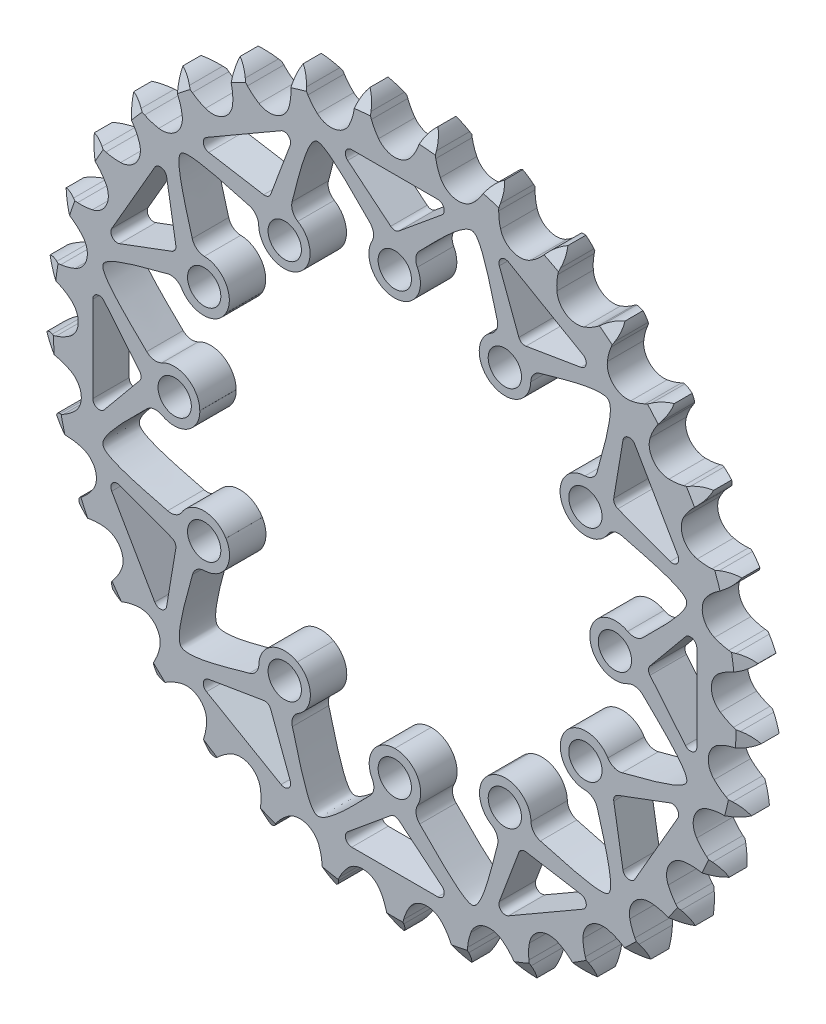
from build123d import *

# Parameters (mm, degrees)
EXTRUSION_DEPTH          = 7.2136
CIRPATTERN1_COUNT        = 12
CUT_EXTRUDE1_DEPTH       = 101.397293257
CUT_EXTRUDE1_DEPTH_BACK  = 101.397293257
SKETCH8_R                = 37
CUT_EXTRUDE4_DEPTH       = 101.397293405
FILLET3_R                = 2.54
CIRPATTERN5_COUNT        = 12
FILLET3_OF_CIRPATTERN5_R = 2.54


with BuildPart() as part:
    # Teeth Sketch → Extrusion (new body)
    with BuildSketch(Plane.XY):
        with BuildLine():
            ThreePointArc((6.734552875, 70.527428506), (5.727412099, 69.369502295), (5.022388138, 68.006393031))
            Line((5.022388138, 68.006393031), (4.635162245, 66.971544668))
            ThreePointArc((4.635162245, 66.971544668), (4.0137299, 65.635158722), (3.209237245, 64.400291471))
            ThreePointArc((3.209237245, 64.400291471), (0, 62.793862006), (-3.209237245, 64.400291471))
            ThreePointArc((-3.209237245, 64.400291471), (-4.0137299, 65.635158722), (-4.635162245, 66.971544668))
            Line((-4.635162245, 66.971544668), (-5.022388138, 68.006393031))
            ThreePointArc((-5.022388138, 68.006393031), (-5.727412099, 69.369502295), (-6.734552875, 70.527428506))
            ThreePointArc((-6.734552875, 70.527428506), (-7.504354329, 69.199824885), (-7.938667464, 67.727922119))
            Line((-7.938667464, 67.727922119), (-8.123049341, 66.638491832))
            ThreePointArc((-8.123049341, 66.638491832), (-8.48033889, 65.208649276), (-9.036593151, 63.84384645))
            ThreePointArc((-9.036593151, 63.84384645), (-11.883816523, 61.659095115), (-15.339077445, 62.629142165))
            ThreePointArc((-15.339077445, 62.629142165), (-16.362732034, 63.68944252), (-17.22584699, 64.884071387))
            Line((-17.22584699, 64.884071387), (-17.801921547, 65.826935709))
            ThreePointArc((-17.801921547, 65.826935709), (-18.752174931, 67.031985151), (-19.960254337, 67.978383482))
            ThreePointArc((-19.960254337, 67.978383482), (-20.464893839, 66.529085505), (-20.61279894, 65.001587639))
            Line((-20.61279894, 65.001587639), (-20.587672758, 63.896950277))
            ThreePointArc((-20.587672758, 63.896950277), (-20.667906137, 62.425329346), (-20.955817525, 60.979918474))
            ThreePointArc((-20.955817525, 60.979918474), (-23.338120953, 58.295807876), (-26.914523421, 58.594412483))
            ThreePointArc((-26.914523421, 58.594412483), (-28.120342399, 59.441823925), (-29.193944743, 60.451518712))
            Line((-29.193944743, 60.451518712), (-29.938047129, 61.268321421))
            ThreePointArc((-29.938047129, 61.268321421), (-31.099185303, 62.271757414), (-32.464540202, 62.972422563))
            ThreePointArc((-32.464540202, 62.972422563), (-32.685778765, 61.453811636), (-32.541930156, 59.925926421))
            Line((-32.541930156, 59.925926421), (-32.308204042, 58.846006456))
            ThreePointArc((-32.308204042, 58.846006456), (-32.108481407, 57.385795366), (-32.117644055, 55.912017363))
            ThreePointArc((-32.117644055, 55.912017363), (-33.948924886, 52.825558252), (-37.517208396, 52.441928068))
            ThreePointArc((-37.517208396, 52.441928068), (-38.861610323, 53.045822938), (-40.106897269, 53.834090646))
            Line((-40.106897269, 53.834090646), (-40.992133685, 54.495310364))
            ThreePointArc((-40.992133685, 54.495310364), (-42.32219009, 55.260866117), (-43.795472998, 55.69047422))
            ThreePointArc((-43.795472998, 55.69047422), (-43.725314484, 54.157436897), (-43.294911229, 52.684386087))
            Line((-43.294911229, 52.684386087), (-42.861032653, 51.668214641))
            ThreePointArc((-42.861032653, 51.668214641), (-42.388572501, 50.272189225), (-42.118655247, 48.823310267))
            ThreePointArc((-42.118655247, 48.823310267), (-43.33272622, 45.446055318), (-46.763923708, 44.394055736))
            ThreePointArc((-46.763923708, 44.394055736), (-48.198318397, 44.732607702), (-49.570282031, 45.270958281))
            Line((-49.570282031, 45.270958281), (-50.564657725, 45.752696804))
            ThreePointArc((-50.564657725, 45.752696804), (-52.015560657, 46.252703137), (-53.543523293, 46.395727039))
            ThreePointArc((-53.543523293, 46.395727039), (-53.184503413, 44.903671283), (-52.483101407, 43.538694772))
            Line((-52.483101407, 43.538694772), (-51.864751871, 42.622998928))
            ThreePointArc((-51.864751871, 42.622998928), (-51.136630142, 41.341615182), (-50.597388499, 39.970001531))
            ThreePointArc((-50.597388499, 39.970001531), (-51.150369926, 36.424013535), (-54.320468976, 34.741666562))
            ThreePointArc((-54.320468976, 34.741666562), (-55.793013665, 34.802639473), (-57.242067645, 35.071615531))
            Line((-57.242067645, 35.071615531), (-58.309643291, 35.356461573))
            ThreePointArc((-58.309643291, 35.356461573), (-59.828953337, 35.572846956), (-61.356371149, 35.424117399))
            ThreePointArc((-61.356371149, 35.424117399), (-60.721465817, 34.026969994), (-59.774415556, 32.819401589))
            Line((-59.774415556, 32.819401589), (-58.993943824, 32.037276981))
            ThreePointArc((-58.993943824, 32.037276981), (-58.036476735, 30.916847451), (-57.2474003, 29.672072798))
            ThreePointArc((-57.2474003, 29.672072798), (-57.119305992, 26.085513002), (-59.913730964, 23.83362304))
            ThreePointArc((-59.913730964, 23.83362304), (-61.371204052, 23.614813176), (-62.844975793, 23.604693218))
            Line((-62.844975793, 23.604693218), (-63.947166423, 23.682351702))
            ThreePointArc((-63.947166423, 23.682351702), (-65.479971761, 23.607295402), (-66.951639889, 23.17218786))
            ThreePointArc((-66.951639889, 23.17218786), (-66.063796239, 21.920445353), (-64.905326586, 20.913929722))
            Line((-64.905326586, 20.913929722), (-63.99094094, 20.293644371))
            ThreePointArc((-63.99094094, 20.293644371), (-62.838733846, 19.374664301), (-61.828341898, 18.301718044))
            ThreePointArc((-61.828341898, 18.301718044), (-61.023801517, 14.804214063), (-63.341554612, 12.064170283))
            ThreePointArc((-63.341554612, 12.064170283), (-64.731279223, 11.573486003), (-66.176502774, 11.28463579))
            Line((-66.176502774, 11.28463579), (-67.273472348, 11.152299936))
            ThreePointArc((-67.273472348, 11.152299936), (-68.764373399, 10.788514683), (-70.127101923, 10.082755077))
            ThreePointArc((-70.127101923, 10.082755077), (-69.018408937, 9.021658703), (-67.690390004, 8.252573944))
            Line((-67.690390004, 8.252573944), (-66.675138724, 7.816546579))
            ThreePointArc((-66.675138724, 7.816546579), (-65.369835391, 7.132230303), (-64.174646128, 6.269891516))
            ThreePointArc((-64.174646128, 6.269891516), (-62.722737859, 2.987852256), (-64.480049441, -0.14131302))
            ThreePointArc((-64.480049441, -0.14131302), (-65.751797307, -0.886137108), (-67.116238523, -1.443277777))
            Line((-67.116238523, -1.443277777), (-68.168339704, -1.780825007))
            ThreePointArc((-68.168339704, -1.780825007), (-69.563451418, -2.420191065), (-70.767987779, -3.371094744))
            ThreePointArc((-70.767987779, -3.371094744), (-69.478516511, -4.203194198), (-68.028946362, -4.707051357))
            Line((-68.028946362, -4.707051357), (-66.949523274, -4.943061572))
            ThreePointArc((-66.949523274, -4.943061572), (-65.538300765, -5.367981082), (-64.201511441, -5.988545228))
            ThreePointArc((-64.201511441, -5.988545228), (-62.154711032, -8.936498316), (-63.288067282, -12.341688903))
            ThreePointArc((-63.288067282, -12.341688903), (-64.395874122, -13.313732915), (-65.630218543, -14.119027525))
            Line((-65.630218543, -14.119027525), (-66.599425651, -14.649586294))
            ThreePointArc((-66.599425651, -14.649586294), (-67.848325057, -15.541424803), (-68.851134172, -16.703104419))
            ThreePointArc((-68.851134172, -16.703104419), (-67.427489473, -17.276132709), (-65.908759351, -17.496551559))
            Line((-65.908759351, -17.496551559), (-64.804177617, -17.524014599))
            ThreePointArc((-64.804177617, -17.524014599), (-63.338041192, -17.674179644), (-61.907966855, -18.030540344))
            ThreePointArc((-61.907966855, -18.030540344), (-59.340251006, -20.537860555), (-59.808689476, -24.096003993))
            ThreePointArc((-59.808689476, -24.096003993), (-60.712516265, -25.260135726), (-61.772151467, -26.284478831))
            Line((-61.772151467, -26.284478831), (-62.623434833, -26.988873364))
            ThreePointArc((-62.623434833, -26.988873364), (-63.680983452, -28.100950955), (-64.445821187, -29.43142038))
            ThreePointArc((-64.445821187, -29.43142038), (-62.939457285, -29.724666771), (-61.406458053, -29.6536808))
            Line((-61.406458053, -29.6536808), (-60.316640136, -29.471604079))
            ThreePointArc((-60.316640136, -29.471604079), (-58.848579784, -29.341587304), (-57.376907048, -29.420864754))
            ThreePointArc((-57.376907048, -29.420864754), (-54.381079699, -31.396931003), (-54.167669802, -34.979426717))
            ThreePointArc((-54.167669802, -34.979426717), (-54.834849884, -36.293571418), (-55.681477891, -37.499940589))
            Line((-55.681477891, -37.499940589), (-56.384069915, -38.352712231))
            ThreePointArc((-56.384069915, -38.352712231), (-57.212045185, -39.644835523), (-57.711268312, -41.096008126))
            ThreePointArc((-57.711268312, -41.096008126), (-56.176629123, -41.09887393), (-54.684767369, -40.739048756))
            Line((-54.684767369, -40.739048756), (-53.649102126, -40.354013001))
            ThreePointArc((-53.649102126, -40.354013001), (-52.232177374, -39.94851355), (-50.772096325, -39.747842457))
            ThreePointArc((-50.772096325, -39.747842457), (-47.456434483, -41.12123456), (-46.56888941, -44.598601821))
            ThreePointArc((-46.56888941, -44.598601821), (-46.975309158, -46.015262876), (-47.578330627, -47.360056788))
            Line((-47.578330627, -47.360056788), (-48.106837804, -48.330384151))
            ThreePointArc((-48.106837804, -48.330384151), (-48.675314541, -49.755852442), (-48.890879835, -51.275279063))
            ThreePointArc((-48.890879835, -51.275279063), (-47.383431219, -50.987660703), (-45.986626711, -50.352001344))
            Line((-45.986626711, -50.352001344), (-45.042545785, -49.777922752))
            ThreePointArc((-45.042545785, -49.777922752), (-43.727967985, -49.111596431), (-42.332249756, -48.638229571))
            ThreePointArc((-42.332249756, -48.638229571), (-38.816590078, -49.35930956), (-37.28698802, -52.605867255))
            ThreePointArc((-37.28698802, -52.605867255), (-37.417958367, -54.073842843), (-37.75557853, -55.50845714))
            Line((-37.75557853, -55.50845714), (-38.090899233, -56.561270064))
            ThreePointArc((-38.090899233, -56.561270064), (-38.379331208, -58.068563217), (-38.303447577, -59.601327819))
            ThreePointArc((-38.303447577, -59.601327819), (-36.877672653, -59.03362057), (-35.626409548, -58.145101414))
            Line((-35.626409548, -58.145101414), (-34.808034481, -57.402728679))
            ThreePointArc((-34.808034481, -57.402728679), (-33.6433159, -56.499658259), (-32.362405386, -55.770704343))
            ThreePointArc((-32.362405386, -55.770704343), (-28.773812973, -55.813410509), (-26.657437732, -58.711819583))
            ThreePointArc((-26.657437732, -58.711819583), (-26.508225068, -60.178053241), (-26.568241455, -61.650637225))
            Line((-26.568241455, -61.650637225), (-26.69825632, -62.747884308))
            ThreePointArc((-26.69825632, -62.747884308), (-26.696218847, -64.28252482), (-26.331628924, -65.773229298))
            ThreePointArc((-26.331628924, -65.773229298), (-25.039058915, -64.94595158), (-23.978561119, -63.836686022))
            Line((-23.978561119, -63.836686022), (-23.31547012, -62.952850431))
            ThreePointArc((-23.31547012, -62.952850431), (-22.342706722, -61.845675228), (-21.222899365, -60.887480551))
            ThreePointArc((-21.222899365, -60.887480551), (-17.691075297, -60.250269381), (-15.06441819, -62.69577378))
            ThreePointArc((-15.06441819, -62.69577378), (-14.640415448, -64.107272002), (-14.42065891, -65.564602652))
            Line((-14.42065891, -65.564602652), (-14.340668861, -66.666626525))
            ThreePointArc((-14.340668861, -66.666626525), (-14.048235582, -68.17314849), (-13.408116596, -69.567914899))
            ThreePointArc((-13.408116596, -69.567914899), (-12.295468348, -68.510966685), (-11.464065017, -67.221046473))
            Line((-11.464065017, -67.221046473), (-10.980223921, -66.227692145))
            ThreePointArc((-10.980223921, -66.227692145), (-10.23457391, -64.956428358), (-9.316342465, -63.80362457))
            ThreePointArc((-9.316342465, -63.80362457), (-5.968936066, -62.509526537), (-2.926931324, -64.413739359))
            ThreePointArc((-2.926931324, -64.413739359), (-2.24346307, -65.719486924), (-1.751876179, -67.108892511))
            Line((-1.751876179, -67.108892511), (-1.464772265, -68.175863162))
            ThreePointArc((-1.464772265, -68.175863162), (-0.89251248, -69.59981695), (0, -70.848234798))
            ThreePointArc((0, -70.848234798), (0.89251248, -69.59981695), (1.464772265, -68.175863162))
            Line((1.464772265, -68.175863162), (1.751876179, -67.108892511))
            ThreePointArc((1.751876179, -67.108892511), (2.24346307, -65.719486924), (2.926931324, -64.413739359))
            ThreePointArc((2.926931324, -64.413739359), (5.968936066, -62.509526537), (9.316342465, -63.80362457))
            ThreePointArc((9.316342465, -63.80362457), (10.23457391, -64.956428358), (10.980223921, -66.227692145))
            Line((10.980223921, -66.227692145), (11.464065017, -67.221046473))
            ThreePointArc((11.464065017, -67.221046473), (12.295468348, -68.510966685), (13.408116596, -69.567914899))
            ThreePointArc((13.408116596, -69.567914899), (14.048235582, -68.17314849), (14.340668861, -66.666626525))
            Line((14.340668861, -66.666626525), (14.42065891, -65.564602652))
            ThreePointArc((14.42065891, -65.564602652), (14.640415448, -64.107272002), (15.06441819, -62.69577378))
            ThreePointArc((15.06441819, -62.69577378), (17.691075297, -60.250269381), (21.222899365, -60.887480551))
            ThreePointArc((21.222899365, -60.887480551), (22.342706722, -61.845675228), (23.31547012, -62.952850431))
            Line((23.31547012, -62.952850431), (23.978561119, -63.836686022))
            ThreePointArc((23.978561119, -63.836686022), (25.039058915, -64.94595158), (26.331628924, -65.773229298))
            ThreePointArc((26.331628924, -65.773229298), (26.696218847, -64.28252482), (26.69825632, -62.747884308))
            Line((26.69825632, -62.747884308), (26.568241455, -61.650637225))
            ThreePointArc((26.568241455, -61.650637225), (26.508225068, -60.178053241), (26.657437732, -58.711819583))
            ThreePointArc((26.657437732, -58.711819583), (28.773812973, -55.813410509), (32.362405386, -55.770704343))
            ThreePointArc((32.362405386, -55.770704343), (33.6433159, -56.499658259), (34.808034481, -57.402728679))
            Line((34.808034481, -57.402728679), (35.626409548, -58.145101414))
            ThreePointArc((35.626409548, -58.145101414), (36.877672653, -59.03362057), (38.303447577, -59.601327819))
            ThreePointArc((38.303447577, -59.601327819), (38.379331208, -58.068563217), (38.090899233, -56.561270064))
            Line((38.090899233, -56.561270064), (37.75557853, -55.50845714))
            ThreePointArc((37.75557853, -55.50845714), (37.417958367, -54.073842843), (37.28698802, -52.605867255))
            ThreePointArc((37.28698802, -52.605867255), (38.816590078, -49.35930956), (42.332249756, -48.638229571))
            ThreePointArc((42.332249756, -48.638229571), (43.727967985, -49.111596431), (45.042545785, -49.777922752))
            Line((45.042545785, -49.777922752), (45.986626711, -50.352001344))
            ThreePointArc((45.986626711, -50.352001344), (47.383431219, -50.987660703), (48.890879835, -51.275279063))
            ThreePointArc((48.890879835, -51.275279063), (48.675314541, -49.755852442), (48.106837804, -48.330384151))
            Line((48.106837804, -48.330384151), (47.578330627, -47.360056788))
            ThreePointArc((47.578330627, -47.360056788), (46.975309158, -46.015262876), (46.56888941, -44.598601821))
            ThreePointArc((46.56888941, -44.598601821), (47.456434483, -41.12123456), (50.772096325, -39.747842457))
            ThreePointArc((50.772096325, -39.747842457), (52.232177374, -39.94851355), (53.649102126, -40.354013001))
            Line((53.649102126, -40.354013001), (54.684767369, -40.739048756))
            ThreePointArc((54.684767369, -40.739048756), (56.176629123, -41.09887393), (57.711268312, -41.096008126))
            ThreePointArc((57.711268312, -41.096008126), (57.212045185, -39.644835523), (56.384069915, -38.352712231))
            Line((56.384069915, -38.352712231), (55.681477891, -37.499940589))
            ThreePointArc((55.681477891, -37.499940589), (54.834849884, -36.293571418), (54.167669802, -34.979426717))
            ThreePointArc((54.167669802, -34.979426717), (54.381079699, -31.396931003), (57.376907048, -29.420864754))
            ThreePointArc((57.376907048, -29.420864754), (58.848579784, -29.341587304), (60.316640136, -29.471604079))
            Line((60.316640136, -29.471604079), (61.406458053, -29.6536808))
            ThreePointArc((61.406458053, -29.6536808), (62.939457285, -29.724666771), (64.445821187, -29.43142038))
            ThreePointArc((64.445821187, -29.43142038), (63.680983452, -28.100950955), (62.623434833, -26.988873364))
            Line((62.623434833, -26.988873364), (61.772151467, -26.284478831))
            ThreePointArc((61.772151467, -26.284478831), (60.712516265, -25.260135726), (59.808689476, -24.096003993))
            ThreePointArc((59.808689476, -24.096003993), (59.340251006, -20.537860555), (61.907966855, -18.030540344))
            ThreePointArc((61.907966855, -18.030540344), (63.338041192, -17.674179644), (64.804177617, -17.524014599))
            Line((64.804177617, -17.524014599), (65.908759351, -17.496551559))
            ThreePointArc((65.908759351, -17.496551559), (67.427489473, -17.276132709), (68.851134172, -16.703104419))
            ThreePointArc((68.851134172, -16.703104419), (67.848325057, -15.541424803), (66.599425651, -14.649586294))
            Line((66.599425651, -14.649586294), (65.630218543, -14.119027525))
            ThreePointArc((65.630218543, -14.119027525), (64.395874122, -13.313732915), (63.288067282, -12.341688903))
            ThreePointArc((63.288067282, -12.341688903), (62.154711032, -8.936498316), (64.201511441, -5.988545228))
            ThreePointArc((64.201511441, -5.988545228), (65.538300765, -5.367981082), (66.949523274, -4.943061572))
            Line((66.949523274, -4.943061572), (68.028946362, -4.707051357))
            ThreePointArc((68.028946362, -4.707051357), (69.478516511, -4.203194198), (70.767987779, -3.371094744))
            ThreePointArc((70.767987779, -3.371094744), (69.563451418, -2.420191065), (68.168339704, -1.780825007))
            Line((68.168339704, -1.780825007), (67.116238523, -1.443277777))
            ThreePointArc((67.116238523, -1.443277777), (65.751797307, -0.886137108), (64.480049441, -0.14131302))
            ThreePointArc((64.480049441, -0.14131302), (62.722737859, 2.987852256), (64.174646128, 6.269891516))
            ThreePointArc((64.174646128, 6.269891516), (65.369835391, 7.132230303), (66.675138724, 7.816546579))
            Line((66.675138724, 7.816546579), (67.690390004, 8.252573944))
            ThreePointArc((67.690390004, 8.252573944), (69.018408937, 9.021658703), (70.127101923, 10.082755077))
            ThreePointArc((70.127101923, 10.082755077), (68.764373399, 10.788514683), (67.273472348, 11.152299936))
            Line((67.273472348, 11.152299936), (66.176502774, 11.28463579))
            ThreePointArc((66.176502774, 11.28463579), (64.731279223, 11.573486003), (63.341554612, 12.064170283))
            ThreePointArc((63.341554612, 12.064170283), (61.023801517, 14.804214063), (61.828341898, 18.301718044))
            ThreePointArc((61.828341898, 18.301718044), (62.838733846, 19.374664301), (63.99094094, 20.293644371))
            Line((63.99094094, 20.293644371), (64.905326586, 20.913929722))
            ThreePointArc((64.905326586, 20.913929722), (66.063796239, 21.920445353), (66.951639889, 23.17218786))
            ThreePointArc((66.951639889, 23.17218786), (65.479971761, 23.607295402), (63.947166423, 23.682351702))
            Line((63.947166423, 23.682351702), (62.844975793, 23.604693218))
            ThreePointArc((62.844975793, 23.604693218), (61.371204052, 23.614813176), (59.913730964, 23.83362304))
            ThreePointArc((59.913730964, 23.83362304), (57.119305992, 26.085513002), (57.2474003, 29.672072798))
            ThreePointArc((57.2474003, 29.672072798), (58.036476735, 30.916847451), (58.993943824, 32.037276981))
            Line((58.993943824, 32.037276981), (59.774415556, 32.819401589))
            ThreePointArc((59.774415556, 32.819401589), (60.721465817, 34.026969994), (61.356371149, 35.424117399))
            ThreePointArc((61.356371149, 35.424117399), (59.828953337, 35.572846956), (58.309643291, 35.356461573))
            Line((58.309643291, 35.356461573), (57.242067645, 35.071615531))
            ThreePointArc((57.242067645, 35.071615531), (55.793013665, 34.802639473), (54.320468976, 34.741666562))
            ThreePointArc((54.320468976, 34.741666562), (51.150369926, 36.424013535), (50.597388499, 39.970001531))
            ThreePointArc((50.597388499, 39.970001531), (51.136630142, 41.341615182), (51.864751871, 42.622998928))
            Line((51.864751871, 42.622998928), (52.483101407, 43.538694772))
            ThreePointArc((52.483101407, 43.538694772), (53.184503413, 44.903671283), (53.543523293, 46.395727039))
            ThreePointArc((53.543523293, 46.395727039), (52.015560657, 46.252703137), (50.564657725, 45.752696804))
            Line((50.564657725, 45.752696804), (49.570282031, 45.270958281))
            ThreePointArc((49.570282031, 45.270958281), (48.198318397, 44.732607702), (46.763923708, 44.394055736))
            ThreePointArc((46.763923708, 44.394055736), (43.33272622, 45.446055318), (42.118655247, 48.823310267))
            ThreePointArc((42.118655247, 48.823310267), (42.388572501, 50.272189225), (42.861032653, 51.668214641))
            Line((42.861032653, 51.668214641), (43.294911229, 52.684386087))
            ThreePointArc((43.294911229, 52.684386087), (43.725314484, 54.157436897), (43.795472998, 55.69047422))
            ThreePointArc((43.795472998, 55.69047422), (42.32219009, 55.260866117), (40.992133685, 54.495310364))
            Line((40.992133685, 54.495310364), (40.106897269, 53.834090646))
            ThreePointArc((40.106897269, 53.834090646), (38.861610323, 53.045822938), (37.517208396, 52.441928068))
            ThreePointArc((37.517208396, 52.441928068), (33.948924886, 52.825558252), (32.117644055, 55.912017363))
            ThreePointArc((32.117644055, 55.912017363), (32.108481407, 57.385795366), (32.308204042, 58.846006456))
            Line((32.308204042, 58.846006456), (32.541930156, 59.925926421))
            ThreePointArc((32.541930156, 59.925926421), (32.685778765, 61.453811636), (32.464540202, 62.972422563))
            ThreePointArc((32.464540202, 62.972422563), (31.099185303, 62.271757414), (29.938047129, 61.268321421))
            Line((29.938047129, 61.268321421), (29.193944743, 60.451518712))
            ThreePointArc((29.193944743, 60.451518712), (28.120342399, 59.441823925), (26.914523421, 58.594412483))
            ThreePointArc((26.914523421, 58.594412483), (23.338120953, 58.295807876), (20.955817525, 60.979918474))
            ThreePointArc((20.955817525, 60.979918474), (20.667906137, 62.425329346), (20.587672758, 63.896950277))
            Line((20.587672758, 63.896950277), (20.61279894, 65.001587639))
            ThreePointArc((20.61279894, 65.001587639), (20.464893839, 66.529085505), (19.960254337, 67.978383482))
            ThreePointArc((19.960254337, 67.978383482), (18.752174931, 67.031985151), (17.801921547, 65.826935709))
            Line((17.801921547, 65.826935709), (17.22584699, 64.884071387))
            ThreePointArc((17.22584699, 64.884071387), (16.362732034, 63.68944252), (15.339077445, 62.629142165))
            ThreePointArc((15.339077445, 62.629142165), (11.883816523, 61.659095115), (9.036593151, 63.84384645))
            ThreePointArc((9.036593151, 63.84384645), (8.48033889, 65.208649276), (8.123049341, 66.638491832))
            Line((8.123049341, 66.638491832), (7.938667464, 67.727922119))
            ThreePointArc((7.938667464, 67.727922119), (7.504354329, 69.199824885), (6.734552875, 70.527428506))
        make_face()
    extrude(amount=EXTRUSION_DEPTH)

    # Sketch7 → M6 Clearance Hole1 (revolve, cut)
    with BuildSketch(Plane(origin=(0, 43.500000122, 0), x_dir=(0, 1, 0), z_dir=(1, 0, 0))):
        Polygon((0, 0), (0, 19.254840043), (3.3, 17.272), (3.3, 0), align=None)
    m6_clearance_hole1 = revolve(axis=Axis((0, 43.500000122, -6.35), (0, 0, 1)), mode=Mode.SUBTRACT)

    # CirPattern1: M6 Clearance Hole1 ×12 about axis
    cirpattern1_axis = Axis((0, -0.110734981, 0), (0, 0, 1))
    for i in range(1, CIRPATTERN1_COUNT):
        add(m6_clearance_hole1.rotate(cirpattern1_axis, i * 360 / CIRPATTERN1_COUNT), mode=Mode.SUBTRACT)

    # Sketch8 → Cut-Extrude1 (cut, two sides: drawn at the far end of the back side and taken through both)
    with BuildSketch(Plane(origin=(0, 0, 0), x_dir=(-1, 0, 0), z_dir=(0, 0, -1)).offset(-CUT_EXTRUDE1_DEPTH_BACK)):
        Circle(SKETCH8_R)
    extrude(amount=CUT_EXTRUDE1_DEPTH + CUT_EXTRUDE1_DEPTH_BACK, mode=Mode.SUBTRACT)

    # Sketch5 → Cut-Revolve1 (revolve, cut)
    with BuildSketch(Plane(origin=(0, 0, 0), x_dir=(0, 0, -1), z_dir=(1, 0, 0))):
        Polygon((-7.2136, -67.654652666), (-7.2136, -70.848234798), (-5.3848, -70.848234798), align=None)
    cut_revolve1 = revolve(axis=Axis((0, 0, 7.2136), (0, 0, -1)), mode=Mode.SUBTRACT)

    # Mirror1: Cut-Revolve1 across plane
    add(cut_revolve1.mirror(Plane.XY.offset(3.6068)), mode=Mode.SUBTRACT)

    # Sketch12 → Cut-Extrude4 (cut, through all)
    with BuildSketch(Plane.XY.offset(7.2136)):
        with BuildLine():
            ThreePointArc((0.807808593, -50.562494605), (0, -50.272466685), (-0.807808593, -50.562494605))
            Line((-0.807808593, -50.562494605), (-9.335504623, -57.592027659))
            ThreePointArc((-9.335504623, -57.592027659), (-9.722991923, -59.001147416), (-8.52769603, -59.841999739))
            Line((-8.52769603, -59.841999739), (8.52769603, -59.841999739))
            ThreePointArc((8.52769603, -59.841999739), (9.722991923, -59.001147416), (9.335504623, -57.592027659))
            Line((9.335504623, -57.592027659), (0.807808593, -50.562494605))
        make_face()
        with BuildLine():
            add(Edge.make_bspline(
                [(-20.866745131, -42.871272678), (-20.665515228, -43.616243701), (-19.613715041, -47.552972019), (-17.101059704, -57.620245734), (-13.557455385, -58.206330024), (-6.6819688, -50.933644341), (-3.862495198, -48.125704991), (-3.308784494, -47.57612249)],
                knots=[0.247545988, 0.247545988, 0.247545988, 0.247545988, 0.302864962, 0.481167418, 0.523691001, 0.728100799, 0.79287719, 0.79287719, 0.79287719, 0.79287719], degree=3))
            ThreePointArc((-3.308784494, -47.57612249), (-4.763823791, -41.957275399), (0, -38.641470085))
            Line((0, -38.641470085), (0, -37))
            ThreePointArc((0, -37), (-9.75165417, -35.691809158), (-18.813739439, -31.859742754))
            Line((-18.813739439, -31.859742754), (-19.544333786, -33.329659737))
            ThreePointArc((-19.544333786, -33.329659737), (-16.773464899, -38.576131524), (-20.866745131, -42.871272678))
        make_face()
    cut_extrude4 = extrude(amount=-CUT_EXTRUDE4_DEPTH, mode=Mode.SUBTRACT)

    # Fillet3
    fillet3_edges = [part.edges().sort_by_distance(p)[0] for p in [
        (-3.308784494, -47.57612249, 3.6068),
        (-20.866745131, -42.871272678, 3.6068),
    ]]
    fillet(fillet3_edges, radius=FILLET3_R)

    # CirPattern5: Cut-Extrude4 ×12 about axis
    cirpattern5_axis = Axis((0, 0, 7.2136), (0, 0, -1))
    for i in range(1, CIRPATTERN5_COUNT):
        add(cut_extrude4.rotate(cirpattern5_axis, i * 360 / CIRPATTERN5_COUNT), mode=Mode.SUBTRACT)

    # Fillet3 of CirPattern5
    fillet3_of_cirpattern5_edges = [part.edges().sort_by_distance(p)[0] for p in [
        (-26.653552673, -39.547738443, 3.6068),
        (-39.506767717, -26.694238666, 3.6068),
        (-42.856522938, -20.922569817, 3.6068),
        (-47.560983798, -3.364504961, 3.6068),
        (-47.57612249, 3.308784494, 3.6068),
        (-42.871272678, 20.866745131, 3.6068),
        (-39.547738443, 26.653552673, 3.6068),
        (-26.694238666, 39.506767717, 3.6068),
        (-20.922569817, 42.856522938, 3.6068),
        (-3.364504961, 47.560983798, 3.6068),
        (3.308784494, 47.57612249, 3.6068),
        (20.866745131, 42.871272678, 3.6068),
        (26.653552673, 39.547738443, 3.6068),
        (39.506767717, 26.694238666, 3.6068),
        (42.856522938, 20.922569817, 3.6068),
        (47.560983798, 3.364504961, 3.6068),
        (47.57612249, -3.308784494, 3.6068),
        (42.871272678, -20.866745131, 3.6068),
        (39.547738443, -26.653552673, 3.6068),
        (26.694238666, -39.506767717, 3.6068),
        (20.922569817, -42.856522938, 3.6068),
        (3.364504961, -47.560983798, 3.6068),
    ]]
    fillet(fillet3_of_cirpattern5_edges, radius=FILLET3_OF_CIRPATTERN5_R)


solid = part.part
